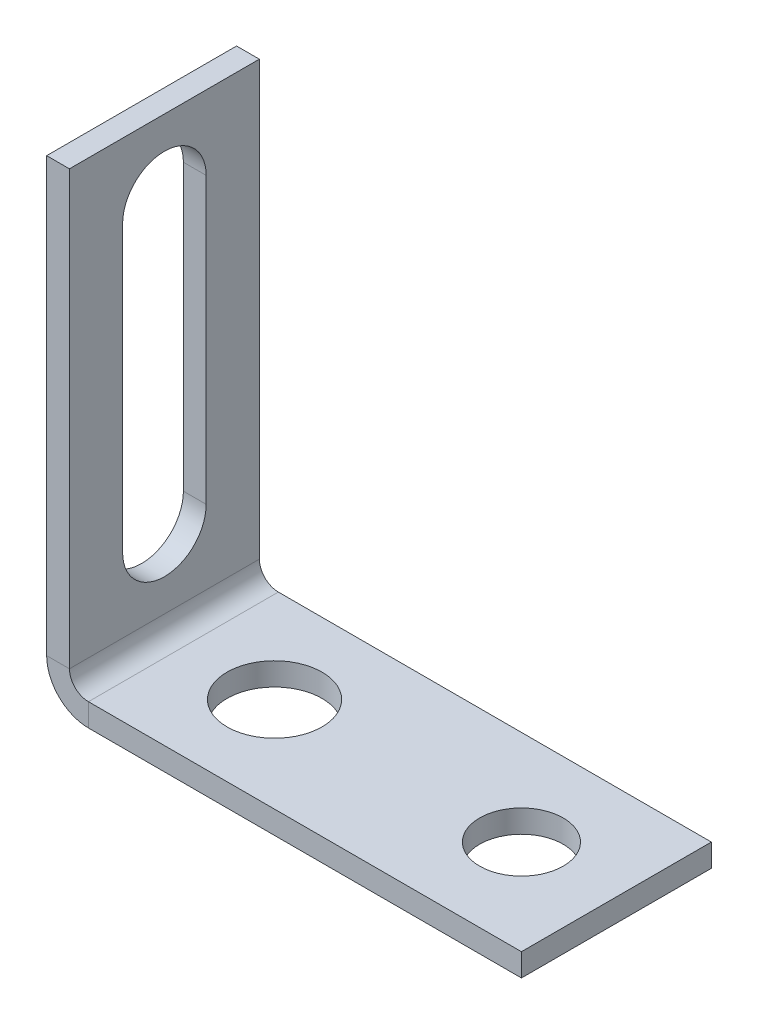
from build123d import *

# Parameters (mm, degrees)
T_LE_DE_BASE_PLI_E1_DEPTH = 10
ENL_V_MAT_EXTRU_1_REACH   = 37.937
ESQUISSE6_R               = 2.2
ESQUISSE6_R_2             = 2.5
ENL_V_MAT_EXTRU_2_REACH   = 37.937


# Sheet-metal steps are written as plain solids
with BuildPart() as part:
    # Esquisse1 → Tôle de base pliée1 (new body)
    with BuildSketch(Plane.XY):
        with BuildLine():
            Line((0, 25), (0, 2.2))
            ThreePointArc((0, 2.2), (0.644365081, 0.644365081), (2.2, 0))
            Line((2.2, 0), (25, 0))
            Line((25, 0), (25, 1.2))
            Line((25, 1.2), (2.2, 1.2))
            ThreePointArc((2.2, 1.2), (1.492893219, 1.492893219), (1.2, 2.2))
            Line((1.2, 2.2), (1.2, 25))
            Line((1.2, 25), (0, 25))
        make_face()
    extrude(amount=T_LE_DE_BASE_PLI_E1_DEPTH)

    # Esquisse6 → Enlèv. mat.-Extru.1 (cut, up to next)
    with BuildSketch(Plane(origin=(0, 1.2, 0), x_dir=(1, 0, 0), z_dir=(0, 1, 0)), mode=Mode.PRIVATE) as enl_v_mat_extru_1_sk1:
        with Locations(Location((20, -5, 0), (0, 0, 270))):
            Circle(ESQUISSE6_R)
    enl_v_mat_extru_1_tool1 = extrude(enl_v_mat_extru_1_sk1.sketch, amount=-ENL_V_MAT_EXTRU_1_REACH, mode=Mode.PRIVATE) & part.part
    # Esquisse6 → Enlèv. mat.-Extru.1 (cut, up to next)
    with BuildSketch(Plane(origin=(0, 1.2, 0), x_dir=(1, 0, 0), z_dir=(0, 1, 0)), mode=Mode.PRIVATE) as enl_v_mat_extru_1_sk2:
        with Locations(Location((7, -5, 0), (0, 0, 270))):
            Circle(ESQUISSE6_R_2)
    enl_v_mat_extru_1_tool2 = extrude(enl_v_mat_extru_1_sk2.sketch, amount=-ENL_V_MAT_EXTRU_1_REACH, mode=Mode.PRIVATE) & part.part
    add(enl_v_mat_extru_1_tool1.solids().sort_by_distance((20, 1.2, 5))[0], mode=Mode.SUBTRACT)
    add(enl_v_mat_extru_1_tool2.solids().sort_by_distance((7, 1.2, 5))[0], mode=Mode.SUBTRACT)

    # Esquisse7 → Enlèv. mat.-Extru.2 (cut, up to next)
    with BuildSketch(Plane(origin=(1.2, 0, 0), x_dir=(0, 0, -1), z_dir=(1, 0, 0)), mode=Mode.PRIVATE) as enl_v_mat_extru_2_sk1:
        with BuildLine():
            Line((-2.8, 21.1), (-2.8, 6.1))
            ThreePointArc((-2.8, 6.1), (-5, 3.9), (-7.2, 6.1))
            Line((-7.2, 6.1), (-7.2, 21.1))
            ThreePointArc((-7.2, 21.1), (-5, 23.3), (-2.8, 21.1))
        make_face()
    enl_v_mat_extru_2_tool1 = extrude(enl_v_mat_extru_2_sk1.sketch, amount=-ENL_V_MAT_EXTRU_2_REACH, mode=Mode.PRIVATE) & part.part
    add(enl_v_mat_extru_2_tool1.solids().sort_by_distance((1.2, 13.6, 5))[0], mode=Mode.SUBTRACT)


solid = part.part
